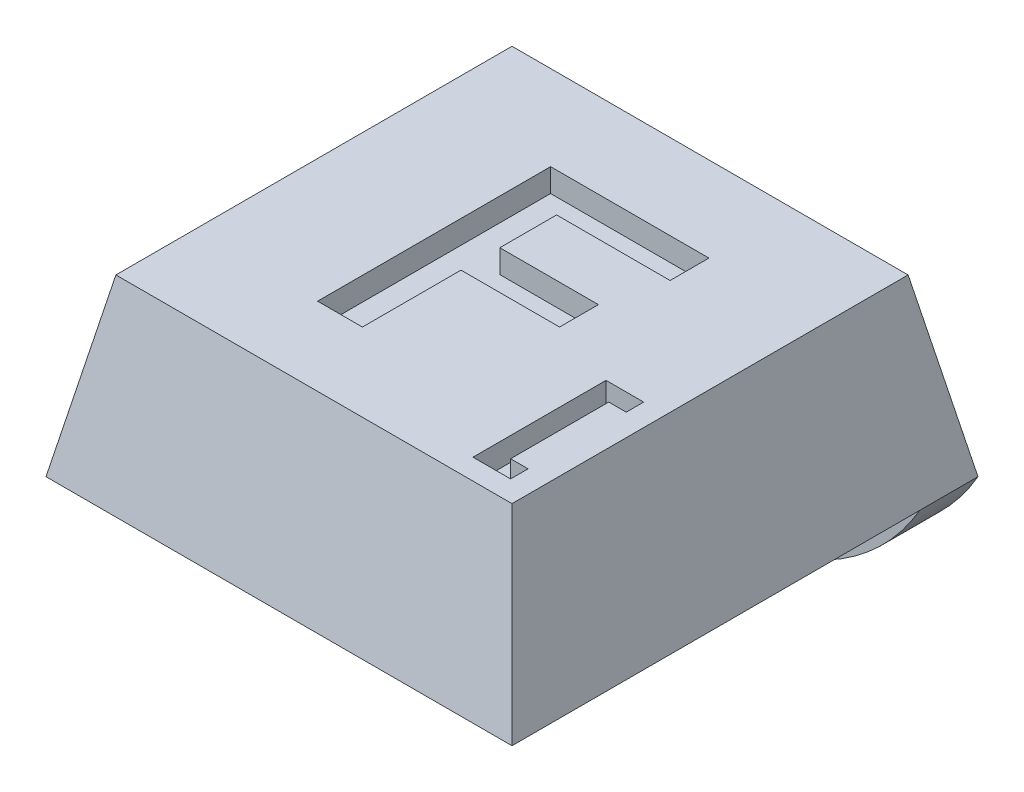
from build123d import *

# Parameters (mm, degrees)
SKETCH1_W               = 8
SKETCH1_H               = 8
BOSS_EXTRUDE1_DEPTH     = 3
CUT_EXTRUDE1_DEPTH      = 12.704699911
CUT_EXTRUDE1_DEPTH_BACK = 12.704699911
CUT_EXTRUDE2_DEPTH      = 11
SKETCH4_R               = 1.75
CUT_EXTRUDE3_DEPTH      = 0.4
SKETCH5_W               = 8
SKETCH5_H               = 1
BOSS_EXTRUDE2_DEPTH     = 2
FILLET1_R               = 4
CUT_EXTRUDE4_DEPTH      = 0.4
CUT_EXTRUDE5_DEPTH      = 0.4


with BuildPart() as part:
    # Sketch1 → Boss-Extrude1 (new body)
    with BuildSketch(Plane(origin=(0, 0, 0), x_dir=(1, 0, 0), z_dir=(0, 1, 0))):
        with Locations((4, 4)):
            Rectangle(SKETCH1_W, SKETCH1_H)
    extrude(amount=BOSS_EXTRUDE1_DEPTH)

    # Sketch2 → Cut-Extrude1 (cut, two sides: drawn at the far end of the back side and taken through both)
    with BuildSketch(Plane.XY.offset(-CUT_EXTRUDE1_DEPTH_BACK)):
        Polygon((0, 0), (0.6, 3), (0, 3), align=None)
        Polygon((8, 0), (7.4, 3), (8, 3), align=None)
    extrude(amount=CUT_EXTRUDE1_DEPTH + CUT_EXTRUDE1_DEPTH_BACK, mode=Mode.SUBTRACT)

    # Sketch3 → Cut-Extrude2 (cut)
    with BuildSketch(Plane(origin=(0, 0, 0), x_dir=(0, 0, -1), z_dir=(1, 0, 0))):
        Polygon((0, 0), (0.6, 3), (0, 3), align=None)
        Polygon((8, 3), (7.4, 3), (8, 0), align=None)
    extrude(amount=CUT_EXTRUDE2_DEPTH, mode=Mode.SUBTRACT)

    # Sketch4 → Cut-Extrude3 (cut)
    with BuildSketch(Plane.XZ):
        with Locations(Location((4, -3.75, 0), (0, 0, 270))):
            Circle(SKETCH4_R)
    extrude(amount=-CUT_EXTRUDE3_DEPTH, mode=Mode.SUBTRACT)

    # Sketch5 → Boss-Extrude2 (add)
    with BuildSketch(Plane.XZ):
        with Locations((4, -7.5)):
            Rectangle(SKETCH5_W, SKETCH5_H)
    extrude(amount=BOSS_EXTRUDE2_DEPTH)

    # Fillet1
    # the kernel refuses this fillet: 4 mm, written as the material it takes off along each edge
    with BuildSketch(Plane(origin=(8, -2, -16.660254038), x_dir=(0, 1, 0), z_dir=(0, 0, 1)), Plane(origin=(0, -2, 1.660254038), x_dir=(0, 1, 0), z_dir=(0, 0, -1))) as fillet1_piece_1:
        with BuildLine():
            CenterArc((4, 3.464101615), FILLET1_R, 180, 60)
            Line((0, 3.464101615), (-0.08, 3.464101615))
            Line((-0.08, 3.464101615), (-0.08, 0))
            Line((-0.08, 0), (0, -0.08))
            ThreePointArc((0, -0.08), (1, -0.08), (1.96, -0.069282032))
            Line((1.96, -0.069282032), (2, 0))
        make_face()
    extrude(amount=18.320508076, mode=Mode.SUBTRACT)

    # Sketch6 → Cut-Extrude4 (cut)
    with BuildSketch(Plane(origin=(0, 3, 0), x_dir=(1, 0, 0), z_dir=(0, 1, 0))):
        Polygon((2.721575188, 1.941169366), (2.721575188, 5.941169366), (5.439523906, 5.941169366), (5.439523906, 5.2745027), (3.490805957, 5.2745027), (3.490805957, 4.300143725), (5.18311365, 4.300143725), (5.18311365, 3.633477059), (3.490805957, 3.633477059), (3.490805957, 1.941169366), align=None)
    extrude(amount=-CUT_EXTRUDE4_DEPTH, mode=Mode.SUBTRACT)

    # Sketch7 → Cut-Extrude5 (cut)
    with BuildSketch(Plane(origin=(0, 3, 0), x_dir=(1, 0, 0), z_dir=(0, 1, 0))):
        Polygon((6.374503362, 0.955347226), (6.374503362, 3.239962611), (7.020657208, 3.239962611), (7.020657208, 2.939962611), (6.720657208, 2.939962611), (6.720657208, 1.255347226), (7.020657208, 1.255347226), (7.020657208, 0.955347226), align=None)
    extrude(amount=-CUT_EXTRUDE5_DEPTH, mode=Mode.SUBTRACT)


solid = part.part
